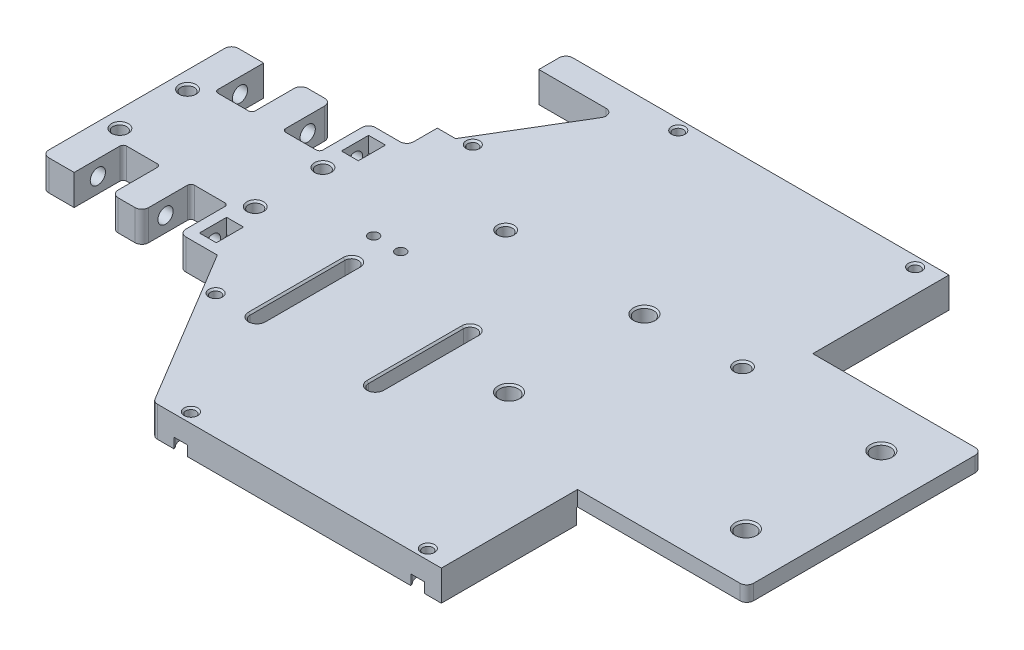
from build123d import *

# Parameters (mm, degrees)
BOSS_EXTRUDE1_DEPTH      = 9
SKETCH3_R                = 2
CUT_EXTRUDE1_DEPTH       = 116.215256417
SKETCH4_W                = 69.5
SKETCH4_H                = 4.5
BOSS_EXTRUDE2_DEPTH      = 50
SKETCH5_W                = 70
SKETCH5_H                = 4.5
CUT_EXTRUDE2_DEPTH       = 45
SKETCH6_R                = 2.75
CUT_EXTRUDE4_DEPTH       = 50
FILLET1_R                = 2
CHAMFER1_SIZE            = 0.5
FILLET2_R                = 2
SKETCH7_W                = 11
SKETCH7_H                = 11.5
CUT_EXTRUDE5_DEPTH       = 157.442640413
SKETCH8_R                = 2.25
CUT_EXTRUDE6_DEPTH       = 50
SKETCH10_R               = 3.5
CUT_EXTRUDE8_DEPTH       = 4
CUT_EXTRUDE9_START       = -3
CUT_EXTRUDE9_DEPTH       = 5
FILLET4_R                = 1
FILLET4_OF_MIRROR2_R     = 1
CUT_EXTRUDE10_DEPTH      = 10
SKETCH15_R               = 1.5
CUT_EXTRUDE12_DEPTH      = 10
SKETCH17_R               = 3.25
CUT_EXTRUDE14_DEPTH      = 3
CHAMFER2_SIZE            = 0.764705882
SKETCH18_W               = 12
SKETCH18_H               = 9
BOSS_EXTRUDE3_DEPTH      = 3
SKETCH20_R               = 2
CUT_EXTRUDE15_DEPTH      = 157.442640413
BOSS_EXTRUDE5_DEPTH      = 3
BOSS_EXTRUDE5_DEPTH_BACK = 26.202556
SKETCH23_W               = 8
SKETCH23_H               = 9
SKETCH23_W_2             = 9
FILLET5_R                = 2
SKETCH24_R               = 3.25
CUT_EXTRUDE17_DEPTH      = 3
SKETCH25_R               = 1.5
CUT_EXTRUDE18_DEPTH      = 157.29875156
SKETCH26_R               = 1.25
CUT_EXTRUDE20_DEPTH      = 5
CHAMFER3_SIZE            = 0.764705882
FILLET6_R                = 2
CHAMFER4_SIZE            = 0.5
SKETCH27_R               = 3.5
CUT_EXTRUDE21_DEPTH      = 3
SKETCH28_R               = 1.5
CUT_EXTRUDE22_DEPTH      = 10
SKETCH29_R               = 2.75
CUT_EXTRUDE23_DEPTH      = 3
SKETCH30_W               = 9
SKETCH30_H               = 9
SKETCH30_W_2             = 9.5
BOSS_EXTRUDE6_DEPTH      = 3
FILLET7_R                = 2


with BuildPart() as part:
    # Sketch1 → Boss-Extrude1 (new body)
    with BuildSketch(Plane(origin=(0, 0, 0), x_dir=(1, 0, 0), z_dir=(0, 1, 0))):
        Polygon((-78.00255572, 25), (-28.00255572, 25), (1.99744428, 75), (86.99744428, 75), (86.99744428, -75), (1.99744428, -75), (-28.00255572, -25), (-78.00255572, -25), align=None)
    extrude(amount=BOSS_EXTRUDE1_DEPTH)

    # Sketch3 → Cut-Extrude1 (cut, through all)
    with BuildSketch(Plane(origin=(0, 9, 0), x_dir=(1, 0, 0), z_dir=(0, 1, 0))):
        with Locations(Location((-73.00255572, 10, 0), (0, 0, 270))):
            Circle(SKETCH3_R)
        with Locations(Location((-33.00255572, 10, 0), (0, 0, 270))):
            Circle(SKETCH3_R)
        with Locations(Location((-33.00255572, -10, 0), (0, 0, 270))):
            Circle(SKETCH3_R)
        with Locations(Location((-73.00255572, -10, 0), (0, 0, 270))):
            Circle(SKETCH3_R)
    extrude(amount=-CUT_EXTRUDE1_DEPTH, mode=Mode.SUBTRACT)

    # Sketch4 → Boss-Extrude2 (add)
    with BuildSketch(Plane(origin=(86.99744428, 0, 0), x_dir=(0, 0, -1), z_dir=(1, 0, 0))):
        with Locations((0, 6.75)):
            Rectangle(SKETCH4_W, SKETCH4_H)
    extrude(amount=BOSS_EXTRUDE2_DEPTH)

    # Sketch5 → Cut-Extrude2 (cut)
    with BuildSketch(Plane(origin=(86.99744428, 0, 0), x_dir=(0, 0, -1), z_dir=(1, 0, 0))):
        with Locations((0, 2.25)):
            Rectangle(SKETCH5_W, SKETCH5_H)
    extrude(amount=-CUT_EXTRUDE2_DEPTH, mode=Mode.SUBTRACT)

    # Sketch6 → Cut-Extrude4 (cut)
    with BuildSketch(Plane(origin=(0, 9, 0), x_dir=(1, 0, 0), z_dir=(0, 1, 0))):
        with Locations(Location((51.99744428, 20, 0), (0, 0, 270))):
            Circle(SKETCH6_R)
        with Locations(Location((51.99744428, -20, 0), (0, 0, 270))):
            Circle(SKETCH6_R)
        with Locations(Location((121.99744428, 20, 0), (0, 0, 270))):
            Circle(SKETCH6_R)
        with Locations(Location((121.99744428, -20, 0), (0, 0, 270))):
            Circle(SKETCH6_R)
    extrude(amount=-CUT_EXTRUDE4_DEPTH, mode=Mode.SUBTRACT)

    # Fillet1
    fillet1_edges = [part.edges().sort_by_distance(p)[0] for p in [
        (1.99744428, 4.5, 75),
        (-28.00255572, 4.5, 25),
        (-28.00255572, 4.5, -25),
        (1.99744428, 4.5, -75),
    ]]
    fillet(fillet1_edges, radius=FILLET1_R)

    # Chamfer1
    chamfer1_edges = [part.edges().sort_by_distance(p)[0] for p in [
        (51.99744428, 9, 17.25),
        (121.99744428, 9, -22.75),
        (121.99744428, 9, 17.25),
        (51.99744428, 9, -22.75),
    ]]
    chamfer(chamfer1_edges, length=CHAMFER1_SIZE)

    # Fillet2
    fillet2_edges = [part.edges().sort_by_distance(p)[0] for p in [
        (136.99744428, 6.75, 34.75),
        (136.99744428, 6.75, -34.75),
    ]]
    fillet(fillet2_edges, radius=FILLET2_R)

    # Sketch7 → Cut-Extrude5 (cut, through all)
    with BuildSketch(Plane(origin=(0, 9, 0), x_dir=(1, 0, 0), z_dir=(0, 1, 0))):
        with Locations((-63.00255572, -19.25)):
            Rectangle(SKETCH7_W, SKETCH7_H)
        with Locations((-43.00255572, -19.25)):
            Rectangle(SKETCH7_W, SKETCH7_H)
    cut_extrude5 = extrude(amount=-CUT_EXTRUDE5_DEPTH, mode=Mode.SUBTRACT)

    # Sketch8 → Cut-Extrude6 (cut)
    with BuildSketch(Plane.ZY.offset(78.00255572)):
        with Locations((21, 4.5)):
            Circle(SKETCH8_R)
    cut_extrude6 = extrude(amount=-CUT_EXTRUDE6_DEPTH, mode=Mode.SUBTRACT)

    # Sketch10 → Cut-Extrude8 (cut)
    with BuildSketch(Plane.ZY.offset(78.00255572)):
        with Locations((21, 4.5)):
            Circle(SKETCH10_R)
    cut_extrude8 = extrude(amount=-CUT_EXTRUDE8_DEPTH, mode=Mode.SUBTRACT)

    # Sketch11 → Cut-Extrude9 (cut)
    with BuildSketch(Plane.ZY.offset(37.50255572).offset(CUT_EXTRUDE9_START)):
        Polygon((16.958548116, 4.5), (16.958548116, 11.77431345), (25.041451884, 11.77431345), (25.041451884, 4.5), (23.020725942, 1), (18.979274058, 1), align=None)
    cut_extrude9 = extrude(amount=-CUT_EXTRUDE9_DEPTH, mode=Mode.SUBTRACT)

    # Fillet4
    fillet4_edges = [part.edges().sort_by_distance(p)[0] for p in [
        (-68.50255572, 4.5, 13.5),
        (-57.50255572, 4.5, 13.5),
        (-48.50255572, 4.5, 13.5),
        (-37.50255572, 4.5, 13.5),
    ]]
    fillet(fillet4_edges, radius=FILLET4_R)

    # Mirror2: Cut-Extrude5, Cut-Extrude6, Cut-Extrude8, Cut-Extrude9 across plane
    add(cut_extrude5.mirror(Plane.XY), mode=Mode.SUBTRACT)
    add(cut_extrude6.mirror(Plane.XY), mode=Mode.SUBTRACT)
    add(cut_extrude8.mirror(Plane.XY), mode=Mode.SUBTRACT)
    add(cut_extrude9.mirror(Plane.XY), mode=Mode.SUBTRACT)

    # Fillet4 of Mirror2
    fillet4_of_mirror2_edges = [part.edges().sort_by_distance(p)[0] for p in [
        (-68.50255572, 4.5, -13.5),
        (-57.50255572, 4.5, -13.5),
        (-48.50255572, 4.5, -13.5),
        (-37.50255572, 4.5, -13.5),
    ]]
    fillet(fillet4_of_mirror2_edges, radius=FILLET4_OF_MIRROR2_R)

    # Sketch12 → Cut-Extrude10 (cut)
    with BuildSketch(Plane(origin=(0, 9, 0), x_dir=(1, 0, 0), z_dir=(0, 1, 0))):
        with BuildLine():
            Line((-6.50255572, -10), (-6.50255572, -38))
            ThreePointArc((-6.50255572, -38), (-4.50255572, -40), (-2.50255572, -38))
            Line((-2.50255572, -38), (-2.50255572, -10))
            ThreePointArc((-2.50255572, -10), (-4.50255572, -8), (-6.50255572, -10))
        make_face()
        with BuildLine():
            Line((28.49744428, -10), (28.49744428, -38))
            ThreePointArc((28.49744428, -38), (30.49744428, -40), (32.49744428, -38))
            Line((32.49744428, -38), (32.49744428, -10))
            ThreePointArc((32.49744428, -10), (30.49744428, -8), (28.49744428, -10))
        make_face()
    extrude(amount=-CUT_EXTRUDE10_DEPTH, mode=Mode.SUBTRACT)

    # Sketch15 → Cut-Extrude12 (cut)
    with BuildSketch(Plane(origin=(0, 9, 0), x_dir=(1, 0, 0), z_dir=(0, 1, 0))):
        with Locations(Location((79.99744428, 72, 0), (0, 0, 270))):
            Circle(SKETCH15_R)
        with Locations(Location((9.99744428, 72, 0), (0, 0, 270))):
            Circle(SKETCH15_R)
        with Locations(Location((-16.703984583, 38, 0), (0, 0, 270))):
            Circle(SKETCH15_R)
        with Locations(Location((-16.703984583, -38, 0), (0, 0, 270))):
            Circle(SKETCH15_R)
        with Locations(Location((9.99744428, -72, 0), (0, 0, 270))):
            Circle(SKETCH15_R)
        with Locations(Location((79.99744428, -72, 0), (0, 0, 270))):
            Circle(SKETCH15_R)
    extrude(amount=-CUT_EXTRUDE12_DEPTH, mode=Mode.SUBTRACT)

    # Sketch17 → Cut-Extrude14 (cut)
    with BuildSketch(Plane.XZ):
        with Locations((9.99744428, 72)):
            Circle(SKETCH17_R)
        with Locations((-16.703984583, 38)):
            Circle(SKETCH17_R)
        with Locations((79.99744428, 72)):
            Circle(SKETCH17_R)
        with Locations((79.99744428, -72)):
            Circle(SKETCH17_R)
        with Locations((-16.703984583, -38)):
            Circle(SKETCH17_R)
        with Locations((9.99744428, -72)):
            Circle(SKETCH17_R)
    extrude(amount=-CUT_EXTRUDE14_DEPTH, mode=Mode.SUBTRACT)

    # Chamfer2
    # the kernel refuses this chamfer: 1, 0.764705882 mm, written as the material it takes off along each edge
    with BuildSketch(Plane(origin=(8.74744428, 3, 75), x_dir=(-0.8297221102000075, 0, -0.5581766923163726), z_dir=(0, -1, 0)), Plane(origin=(78.74744428, 3, 75), x_dir=(-0.8297221102000174, 0, -0.5581766923163579), z_dir=(0, -1, 0)), Plane(origin=(-19.919583054, 3, 38.471621109), x_dir=(0.051744061076638335, 0, -0.9986603787791408), z_dir=(0, -1, 0)), Plane(origin=(11.24744428, 3, -75), x_dir=(0.8297221102000002, 0, 0.5581766923163836), z_dir=(0, -1, 0)), Plane(origin=(81.24744428, 3, -75), x_dir=(0.8297221102000174, 0, 0.5581766923163579), z_dir=(0, -1, 0))) as chamfer2_piece_1:
        with BuildLine():
            Line((1.274754878, 0), (CHAMFER2_SIZE * 0.829722110583, -CHAMFER2_SIZE * 0.558176692574))
            Line((CHAMFER2_SIZE * 0.829722110583, -CHAMFER2_SIZE * 0.558176692574), (0, 0))
            ThreePointArc((0, 0), (0.654407051, -0.063068187), (1.274754878, 0))
        make_face()
    extrude(amount=6.270562656, mode=Mode.SUBTRACT)
    with BuildSketch(Plane(origin=(11.24744428, 3, 75), x_dir=(0.8297221102000084, 0, -0.5581766923163713), z_dir=(0, -1, 0)), Plane(origin=(81.24744428, 3, 75), x_dir=(0.8297221102000208, 0, -0.5581766923163527), z_dir=(0, -1, 0)), Plane(origin=(-18.633343666, 3, 40.615353423), x_dir=(0.905521068841191, 0, 0.42430130082844103), z_dir=(0, -1, 0)), Plane(origin=(8.74744428, 3, -75), x_dir=(-0.8297221102000045, 0, 0.5581766923163772), z_dir=(0, -1, 0)), Plane(origin=(78.74744428, 3, -75), x_dir=(-0.8297221102000106, 0, 0.5581766923163681), z_dir=(0, -1, 0))) as chamfer2_piece_2:
        with BuildLine():
            Line((1.274754878, 0), (CHAMFER2_SIZE * 0.829722110583, CHAMFER2_SIZE * 0.558176692574))
            Line((CHAMFER2_SIZE * 0.829722110583, CHAMFER2_SIZE * 0.558176692574), (0, 0))
            ThreePointArc((0, 0), (0.654407051, 0.063068187), (1.274754878, 0))
        make_face()
    extrude(amount=6.270562656, mode=Mode.SUBTRACT)

    # Sketch18 → Boss-Extrude3 (add)
    with BuildSketch(Plane.XY.offset(25)):
        with Locations((-31.50255572, 4.5)):
            Rectangle(SKETCH18_W, SKETCH18_H)
    boss_extrude3 = extrude(amount=BOSS_EXTRUDE3_DEPTH)

    # Mirror3: Boss-Extrude3 across plane
    add(boss_extrude3.mirror(Plane.XY))

    # Sketch20 → Cut-Extrude15 (cut, through all)
    with BuildSketch(Plane(origin=(0, 9, 0), x_dir=(1, 0, 0), z_dir=(0, 1, 0))):
        with Locations(Location((9.99744428, 21, 0), (0, 0, 270))):
            Circle(SKETCH20_R)
        with Locations(Location((79.99744428, 21, 0), (0, 0, 270))):
            Circle(SKETCH20_R)
    extrude(amount=-CUT_EXTRUDE15_DEPTH, mode=Mode.SUBTRACT)

    # Sketch23 → Boss-Extrude5 (add, two sides: drawn at the far end of the back side and taken through both)
    with BuildSketch(Plane(origin=(0, 0, 0), x_dir=(0, 0, -1), z_dir=(1, 0, 0)).offset(-BOSS_EXTRUDE5_DEPTH_BACK)):
        with Locations((71, 4.5)):
            Rectangle(SKETCH23_W, SKETCH23_H)
        with Locations((32.5, 4.5)):
            Rectangle(SKETCH23_W_2, SKETCH23_H)
    extrude(amount=BOSS_EXTRUDE5_DEPTH + BOSS_EXTRUDE5_DEPTH_BACK)

    # Fillet5
    fillet5_edges = [part.edges().sort_by_distance(p)[0] for p in [
        (-26.20255572, 4.5, -28),
    ]]
    fillet(fillet5_edges, radius=FILLET5_R)

    # Sketch24 → Cut-Extrude17 (cut)
    with BuildSketch(Plane.XZ):
        with Locations((9.99744428, -72)):
            Circle(SKETCH24_R)
        with Locations((-16.703984583, -38)):
            Circle(SKETCH24_R)
    extrude(amount=-CUT_EXTRUDE17_DEPTH, mode=Mode.SUBTRACT)

    # Sketch25 → Cut-Extrude18 (cut, through all)
    with BuildSketch(Plane.XZ.offset(-3)):
        with Locations(Location((-16.703984583, -38, 0), (0, 0, 90))):
            Circle(SKETCH25_R)
    extrude(amount=-CUT_EXTRUDE18_DEPTH, mode=Mode.SUBTRACT)

    # Sketch26 → Cut-Extrude20 (cut)
    with BuildSketch(Plane.ZY.offset(26.20255572)):
        with Locations((-70, 4.5)):
            Circle(SKETCH26_R)
        with Locations((-33, 4.5)):
            Circle(SKETCH26_R)
    extrude(amount=-CUT_EXTRUDE20_DEPTH, mode=Mode.SUBTRACT)

    # Chamfer3
    # the kernel refuses this chamfer: 1, 0.764705882 mm, written as the material it takes off along each edge
    with BuildSketch(Plane(origin=(-18.633343666, 3, -40.615353423), x_dir=(0.5144957554275292, 0, -0.8574929257125425), z_dir=(0, -1, 0))) as chamfer3_piece_1:
        with BuildLine():
            Line((CHAMFER3_SIZE, 0), (1.057692308, 0.711538462))
            ThreePointArc((1.057692308, 0.711538462), (0.578179192, 0.312945694), (0, 0))
            Line((0, 0), (CHAMFER3_SIZE, 0))
        make_face()
    extrude(amount=6.270562656, mode=Mode.SUBTRACT)
    with BuildSketch(Plane(origin=(-19.919583054, 3, -38.471621109), x_dir=(-0.5144957554275258, 0, 0.8574929257125445), z_dir=(0, -1, 0))) as chamfer3_piece_2:
        with BuildLine():
            Line((CHAMFER3_SIZE, 0), (1.057692308, -0.711538462))
            ThreePointArc((1.057692308, -0.711538462), (0.578179192, -0.312945694), (0, 0))
            Line((0, 0), (CHAMFER3_SIZE, 0))
        make_face()
    extrude(amount=6.270562656, mode=Mode.SUBTRACT)

    # Fillet6
    fillet6_edges = [part.edges().sort_by_distance(p)[0] for p in [
        (-2.80255572, 4.5, -67),
        (-26.202556, 4.5, -75),
    ]]
    fillet(fillet6_edges, radius=FILLET6_R)

    # Chamfer4
    chamfer4_edges = [part.edges().sort_by_distance(p)[0] for p in [
        (-73.00255572, 9, 8),
        (-33.00255572, 9, 8),
        (-33.00255572, 9, -12),
        (-73.00255572, 9, -12),
        (-4.50255572, 9, 8),
        (-6.50255572, 9, 24),
        (-4.50255572, 9, 40),
        (-2.50255572, 9, 24),
        (30.49744428, 9, 8),
        (28.49744428, 9, 24),
        (30.49744428, 9, 40),
        (32.49744428, 9, 24),
        (79.99744428, 9, 70.5),
        (9.99744428, 9, 70.5),
        (-16.703984583, 9, 36.5),
        (-16.703984583, 9, -39.5),
        (9.99744428, 9, -73.5),
        (79.99744428, 9, -73.5),
        (9.99744428, 9, -23),
        (79.99744428, 9, -23),
    ]]
    chamfer(chamfer4_edges, length=CHAMFER4_SIZE)

    # Sketch27 → Cut-Extrude21 (cut)
    with BuildSketch(Plane.XZ):
        with Locations(Location((9.99744428, -21, 0), (0, 0, 270))):
            Circle(SKETCH27_R)
    extrude(amount=-CUT_EXTRUDE21_DEPTH, mode=Mode.SUBTRACT)

    # Sketch28 → Cut-Extrude22 (cut)
    with BuildSketch(Plane(origin=(0, 9, 0), x_dir=(1, 0, 0), z_dir=(0, 1, 0))):
        with Locations(Location((-8.00255572, 0, 0), (0, 0, 270))):
            Circle(SKETCH28_R)
        with Locations(Location((-0.00255572, 0, 0), (0, 0, 270))):
            Circle(SKETCH28_R)
    extrude(amount=-CUT_EXTRUDE22_DEPTH, mode=Mode.SUBTRACT)

    # Sketch29 → Cut-Extrude23 (cut)
    with BuildSketch(Plane.XZ):
        with Locations(Location((-8.00255572, 0, 0), (0, 0, 270))):
            Circle(SKETCH29_R)
        with Locations(Location((-0.00255572, 0, 0), (0, 0, 270))):
            Circle(SKETCH29_R)
    extrude(amount=-CUT_EXTRUDE23_DEPTH, mode=Mode.SUBTRACT)

    # Sketch30 → Boss-Extrude6 (add)
    with BuildSketch(Plane(origin=(0, 0, -25), x_dir=(-1, 0, 0), z_dir=(0, 0, -1))):
        with Locations((53.00255572, 4.5)):
            Rectangle(SKETCH30_W, SKETCH30_H)
        with Locations((73.25255572, 4.5)):
            Rectangle(SKETCH30_W_2, SKETCH30_H)
    boss_extrude6 = extrude(amount=BOSS_EXTRUDE6_DEPTH)

    # Mirror4: Boss-Extrude6 across plane
    add(boss_extrude6.mirror(Plane.XY))

    # Fillet7
    fillet7_edges = [part.edges().sort_by_distance(p)[0] for p in [
        (-37.50255572, 4.5, 28),
        (-37.50255572, 4.5, -28),
        (-57.50255572, 4.5, -28),
        (-48.50255572, 4.5, -28),
        (-78.00255572, 4.5, -28),
        (-57.50255572, 4.5, 28),
        (-48.50255572, 4.5, 28),
        (-78.00255572, 4.5, 28),
    ]]
    fillet(fillet7_edges, radius=FILLET7_R)


solid = part.part
